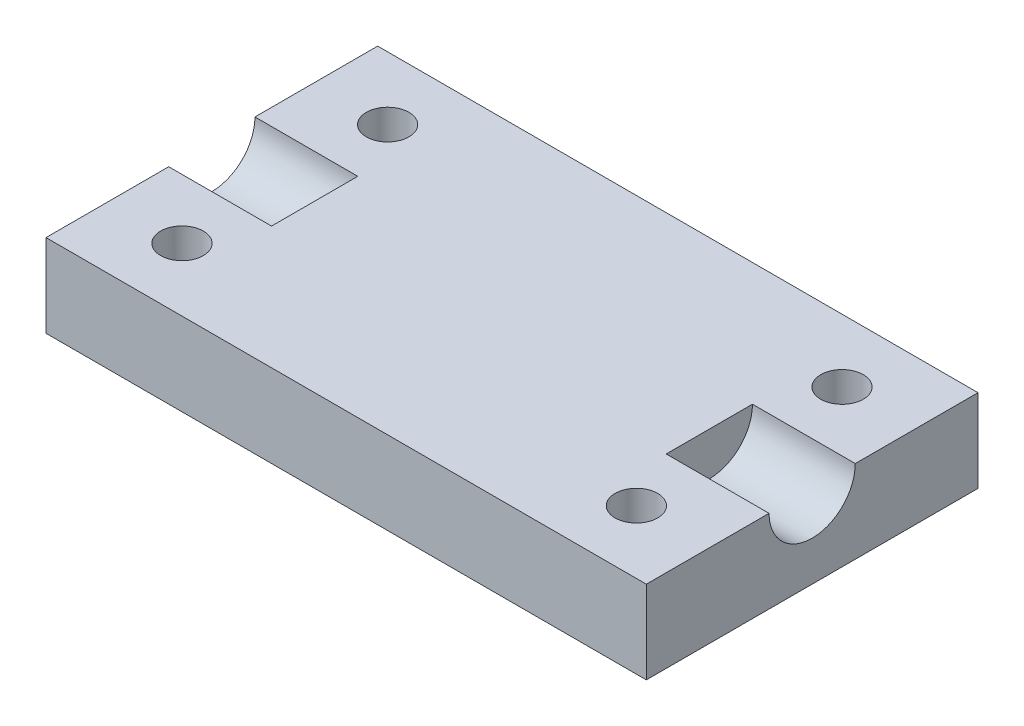
from build123d import *

# Parameters (mm, degrees)
SKETCH1_W           = 45.974
SKETCH1_H           = 25.4
BOSS_EXTRUDE1_DEPTH = 6.35
SKETCH2_R           = 3.302
CUT_EXTRUDE1_DEPTH  = 7.874
CUT_EXTRUDE2_START  = -7.874
SKETCH3_R           = 3.302
CUT_EXTRUDE2_DEPTH  = 7.874
CUT_EXTRUDE11_REACH = 29.019
SKETCH4_R           = 1.63195


with BuildPart() as part:
    # Sketch1 → Boss-Extrude1 (new body)
    with BuildSketch(Plane(origin=(0, 0, 0), x_dir=(1, 0, 0), z_dir=(0, 1, 0))):
        Rectangle(SKETCH1_W, SKETCH1_H)
    extrude(amount=-BOSS_EXTRUDE1_DEPTH)

    # Sketch2 → Cut-Extrude1 (cut)
    with BuildSketch(Plane(origin=(22.987, 0, 0), x_dir=(0, 0, -1), z_dir=(1, 0, 0))):
        Circle(SKETCH2_R)
    extrude(amount=-CUT_EXTRUDE1_DEPTH, mode=Mode.SUBTRACT)

    # Sketch3 → Cut-Extrude2 (cut)
    with BuildSketch(Plane.ZY.offset(22.987).offset(CUT_EXTRUDE2_START)):
        Circle(SKETCH3_R)
    extrude(amount=CUT_EXTRUDE2_DEPTH, mode=Mode.SUBTRACT)

    # Sketch4 → Cut-Extrude11 (cut, up to next)
    with BuildSketch(Plane(origin=(0, 0, 0), x_dir=(1, 0, 0), z_dir=(0, 1, 0)), mode=Mode.PRIVATE) as cut_extrude11_sk1:
        with Locations((17.399, -7.874)):
            Circle(SKETCH4_R)
    cut_extrude11_tool1 = extrude(cut_extrude11_sk1.sketch, amount=-CUT_EXTRUDE11_REACH, mode=Mode.PRIVATE) & part.part
    # Sketch4 → Cut-Extrude11 (cut, up to next)
    with BuildSketch(Plane(origin=(0, 0, 0), x_dir=(1, 0, 0), z_dir=(0, 1, 0)), mode=Mode.PRIVATE) as cut_extrude11_sk2:
        with Locations((17.399, 7.874)):
            Circle(SKETCH4_R)
    cut_extrude11_tool2 = extrude(cut_extrude11_sk2.sketch, amount=-CUT_EXTRUDE11_REACH, mode=Mode.PRIVATE) & part.part
    # Sketch4 → Cut-Extrude11 (cut, up to next)
    with BuildSketch(Plane(origin=(0, 0, 0), x_dir=(1, 0, 0), z_dir=(0, 1, 0)), mode=Mode.PRIVATE) as cut_extrude11_sk3:
        with Locations((-17.399, 7.874)):
            Circle(SKETCH4_R)
    cut_extrude11_tool3 = extrude(cut_extrude11_sk3.sketch, amount=-CUT_EXTRUDE11_REACH, mode=Mode.PRIVATE) & part.part
    # Sketch4 → Cut-Extrude11 (cut, up to next)
    with BuildSketch(Plane(origin=(0, 0, 0), x_dir=(1, 0, 0), z_dir=(0, 1, 0)), mode=Mode.PRIVATE) as cut_extrude11_sk4:
        with Locations((-17.399, -7.874)):
            Circle(SKETCH4_R)
    cut_extrude11_tool4 = extrude(cut_extrude11_sk4.sketch, amount=-CUT_EXTRUDE11_REACH, mode=Mode.PRIVATE) & part.part
    add(cut_extrude11_tool1.solids().sort_by_distance((17.399, 0, 7.874))[0], mode=Mode.SUBTRACT)
    add(cut_extrude11_tool2.solids().sort_by_distance((17.399, 0, -7.874))[0], mode=Mode.SUBTRACT)
    add(cut_extrude11_tool3.solids().sort_by_distance((-17.399, 0, -7.874))[0], mode=Mode.SUBTRACT)
    add(cut_extrude11_tool4.solids().sort_by_distance((-17.399, 0, 7.874))[0], mode=Mode.SUBTRACT)


solid = part.part
